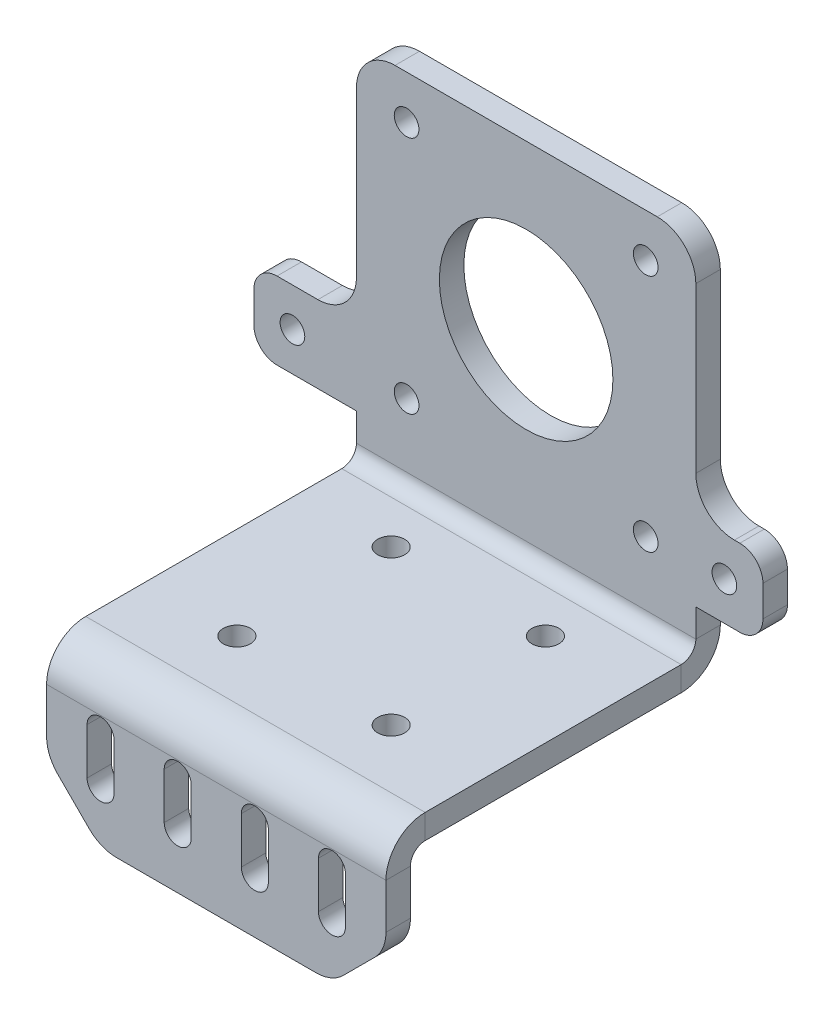
from build123d import *

# Parameters (mm, degrees)
SKETCH1_W                    = 44
SKETCH1_H                    = 37
SKETCH1_R                    = 1.75
BASE_FLANGE1_DEPTH           = 3.175
EDGE_FLANGE1_STRIP_W         = 16.51
EDGE_FLANGE1_STRIP_H         = 3.175
EDGE_FLANGE1_STRIP_CUT_DEPTH = 44
EDGE_FLANGE1_DEPTH           = 44
EDGE_FLANGE2_STRIP_W         = 16.51
EDGE_FLANGE2_STRIP_H         = 3.175
EDGE_FLANGE2_STRIP_CUT_DEPTH = 44
EDGE_FLANGE2_DEPTH           = 44
CUT_EXTRUDE1_REACH           = 69.497
SKETCH12_R                   = 11.25
SKETCH12_R_2                 = 1.6
CUT_EXTRUDE2_REACH           = 69.497
CHAMFER1_SIZE                = 7
FILLET1_R                    = 5
SKETCH14_W                   = 8.7
SKETCH14_H                   = 10
SKETCH14_R                   = 1.6
SKETCH14_W_2                 = 13.3
BOSS_EXTRUDE1_DEPTH          = 3.175
FILLET2_R                    = 5
FILLET3_R                    = 3


# Sheet-metal steps are written as plain solids
with BuildPart() as part:
    # Sketch1 → Base-Flange1 (new body)
    with BuildSketch(Plane(origin=(0, 0, 0), x_dir=(1, 0, 0), z_dir=(0, 1, 0))):
        Rectangle(SKETCH1_W, SKETCH1_H)
        with Locations(Location((-10, 11, 0), (0, 0, 270))):
            Circle(SKETCH1_R, mode=Mode.SUBTRACT)
        with Locations(Location((10, 11, 0), (0, 0, 270))):
            Circle(SKETCH1_R, mode=Mode.SUBTRACT)
        with Locations(Location((10, -9, 0), (0, 0, 270))):
            Circle(SKETCH1_R, mode=Mode.SUBTRACT)
        with Locations(Location((-10, -9, 0), (0, 0, 270))):
            Circle(SKETCH1_R, mode=Mode.SUBTRACT)
    extrude(amount=-BASE_FLANGE1_DEPTH)

    # Edge-Flange1 strip (across the edge) → Edge-Flange1 strip cut (cut)
    with BuildSketch(Plane(origin=(22, 0, -18.5), x_dir=(0, 0, 1), z_dir=(-1, 0, 0))):
        with Locations((-6.35, -1.5875)):
            Rectangle(EDGE_FLANGE1_STRIP_W, EDGE_FLANGE1_STRIP_H)
    extrude(amount=EDGE_FLANGE1_STRIP_CUT_DEPTH, mode=Mode.SUBTRACT)

    # Edge-Flange1 section (across the edge) → Edge-Flange1 (add)
    with BuildSketch(Plane(origin=(22, 0, -18.5), x_dir=(0, 0, 1), z_dir=(-1, 0, 0))):
        with BuildLine():
            Line((-3.175, 1.905), (-3.175, 46.825))
            Line((-3.175, 46.825), (0, 46.825))
            Line((0, 46.825), (0, 1.905))
            ThreePointArc((0, 1.905), (0.557961582, 0.557961582), (1.905, 0))
            Line((1.905, 0), (1.905, -3.175))
            ThreePointArc((1.905, -3.175), (-1.687102448, -1.687102448), (-3.175, 1.905))
        make_face()
    extrude(amount=EDGE_FLANGE1_DEPTH)

    # Edge-Flange2 strip (across the edge) → Edge-Flange2 strip cut (cut)
    with BuildSketch(Plane(origin=(22, -3.175, 18.5), x_dir=(0, 0, -1), z_dir=(-1, 0, 0))):
        with Locations((-6.35, -1.5875)):
            Rectangle(EDGE_FLANGE2_STRIP_W, EDGE_FLANGE2_STRIP_H)
    extrude(amount=EDGE_FLANGE2_STRIP_CUT_DEPTH, mode=Mode.SUBTRACT)

    # Edge-Flange2 section (across the edge) → Edge-Flange2 (add)
    with BuildSketch(Plane(origin=(22, -3.175, 18.5), x_dir=(0, 0, -1), z_dir=(-1, 0, 0))):
        with BuildLine():
            Line((-3.175, 1.905), (-3.175, 16.825))
            Line((-3.175, 16.825), (0, 16.825))
            Line((0, 16.825), (0, 1.905))
            ThreePointArc((0, 1.905), (0.557961582, 0.557961582), (1.905, 0))
            Line((1.905, 0), (1.905, -3.175))
            ThreePointArc((1.905, -3.175), (-1.687102448, -1.687102448), (-3.175, 1.905))
        make_face()
    extrude(amount=EDGE_FLANGE2_DEPTH)

    # Sketch12 → Cut-Extrude1 (cut, up to next)
    with BuildSketch(Plane(origin=(0, 0, -21.675), x_dir=(-1, 0, 0), z_dir=(0, 0, -1)), mode=Mode.PRIVATE) as cut_extrude1_sk1:
        with Locations(Location((0, 25.675, 0), (0, 0, 90))):
            Circle(SKETCH12_R)
    cut_extrude1_tool1 = extrude(cut_extrude1_sk1.sketch, amount=-CUT_EXTRUDE1_REACH, mode=Mode.PRIVATE) & part.part
    # Sketch12 → Cut-Extrude1 (cut, up to next)
    with BuildSketch(Plane(origin=(0, 0, -21.675), x_dir=(-1, 0, 0), z_dir=(0, 0, -1)), mode=Mode.PRIVATE) as cut_extrude1_sk2:
        with Locations(Location((15.5, 41.175, 0), (0, 0, 90))):
            Circle(SKETCH12_R_2)
    cut_extrude1_tool2 = extrude(cut_extrude1_sk2.sketch, amount=-CUT_EXTRUDE1_REACH, mode=Mode.PRIVATE) & part.part
    # Sketch12 → Cut-Extrude1 (cut, up to next)
    with BuildSketch(Plane(origin=(0, 0, -21.675), x_dir=(-1, 0, 0), z_dir=(0, 0, -1)), mode=Mode.PRIVATE) as cut_extrude1_sk3:
        with Locations(Location((15.5, 10.175, 0), (0, 0, 90))):
            Circle(SKETCH12_R_2)
    cut_extrude1_tool3 = extrude(cut_extrude1_sk3.sketch, amount=-CUT_EXTRUDE1_REACH, mode=Mode.PRIVATE) & part.part
    # Sketch12 → Cut-Extrude1 (cut, up to next)
    with BuildSketch(Plane(origin=(0, 0, -21.675), x_dir=(-1, 0, 0), z_dir=(0, 0, -1)), mode=Mode.PRIVATE) as cut_extrude1_sk4:
        with Locations(Location((-15.5, 10.175, 0), (0, 0, 90))):
            Circle(SKETCH12_R_2)
    cut_extrude1_tool4 = extrude(cut_extrude1_sk4.sketch, amount=-CUT_EXTRUDE1_REACH, mode=Mode.PRIVATE) & part.part
    # Sketch12 → Cut-Extrude1 (cut, up to next)
    with BuildSketch(Plane(origin=(0, 0, -21.675), x_dir=(-1, 0, 0), z_dir=(0, 0, -1)), mode=Mode.PRIVATE) as cut_extrude1_sk5:
        with Locations(Location((-15.5, 41.175, 0), (0, 0, 90))):
            Circle(SKETCH12_R_2)
    cut_extrude1_tool5 = extrude(cut_extrude1_sk5.sketch, amount=-CUT_EXTRUDE1_REACH, mode=Mode.PRIVATE) & part.part
    add(cut_extrude1_tool1.solids().sort_by_distance((0, 25.675, -21.675))[0], mode=Mode.SUBTRACT)
    add(cut_extrude1_tool2.solids().sort_by_distance((-15.5, 41.175, -21.675))[0], mode=Mode.SUBTRACT)
    add(cut_extrude1_tool3.solids().sort_by_distance((-15.5, 10.175, -21.675))[0], mode=Mode.SUBTRACT)
    add(cut_extrude1_tool4.solids().sort_by_distance((15.5, 10.175, -21.675))[0], mode=Mode.SUBTRACT)
    add(cut_extrude1_tool5.solids().sort_by_distance((15.5, 41.175, -21.675))[0], mode=Mode.SUBTRACT)

    # Sketch13 → Cut-Extrude2 (cut, up to next)
    with BuildSketch(Plane.XY.offset(21.675), mode=Mode.PRIVATE) as cut_extrude2_sk1:
        with BuildLine():
            Line((-6.75, -12.975), (-6.75, -6.975))
            ThreePointArc((-6.75, -6.975), (-5, -5.225), (-3.25, -6.975))
            Line((-3.25, -6.975), (-3.25, -12.975))
            ThreePointArc((-3.25, -12.975), (-5, -14.725), (-6.75, -12.975))
        make_face()
    cut_extrude2_tool1 = extrude(cut_extrude2_sk1.sketch, amount=-CUT_EXTRUDE2_REACH, mode=Mode.PRIVATE) & part.part
    # Sketch13 → Cut-Extrude2 (cut, up to next)
    with BuildSketch(Plane.XY.offset(21.675), mode=Mode.PRIVATE) as cut_extrude2_sk2:
        with BuildLine():
            Line((-16.75, -12.975), (-16.75, -6.975))
            ThreePointArc((-16.75, -6.975), (-15, -5.225), (-13.25, -6.975))
            Line((-13.25, -6.975), (-13.25, -12.975))
            ThreePointArc((-13.25, -12.975), (-15, -14.725), (-16.75, -12.975))
        make_face()
    cut_extrude2_tool2 = extrude(cut_extrude2_sk2.sketch, amount=-CUT_EXTRUDE2_REACH, mode=Mode.PRIVATE) & part.part
    # Sketch13 → Cut-Extrude2 (cut, up to next)
    with BuildSketch(Plane.XY.offset(21.675), mode=Mode.PRIVATE) as cut_extrude2_sk3:
        with BuildLine():
            Line((16.75, -12.975), (16.75, -6.975))
            ThreePointArc((16.75, -6.975), (15, -5.225), (13.25, -6.975))
            Line((13.25, -6.975), (13.25, -12.975))
            ThreePointArc((13.25, -12.975), (15, -14.725), (16.75, -12.975))
        make_face()
    cut_extrude2_tool3 = extrude(cut_extrude2_sk3.sketch, amount=-CUT_EXTRUDE2_REACH, mode=Mode.PRIVATE) & part.part
    # Sketch13 → Cut-Extrude2 (cut, up to next)
    with BuildSketch(Plane.XY.offset(21.675), mode=Mode.PRIVATE) as cut_extrude2_sk4:
        with BuildLine():
            Line((6.75, -12.975), (6.75, -6.975))
            ThreePointArc((6.75, -6.975), (5, -5.225), (3.25, -6.975))
            Line((3.25, -6.975), (3.25, -12.975))
            ThreePointArc((3.25, -12.975), (5, -14.725), (6.75, -12.975))
        make_face()
    cut_extrude2_tool4 = extrude(cut_extrude2_sk4.sketch, amount=-CUT_EXTRUDE2_REACH, mode=Mode.PRIVATE) & part.part
    add(cut_extrude2_tool1.solids().sort_by_distance((-5, -9.975, 21.675))[0], mode=Mode.SUBTRACT)
    add(cut_extrude2_tool2.solids().sort_by_distance((-15, -9.975, 21.675))[0], mode=Mode.SUBTRACT)
    add(cut_extrude2_tool3.solids().sort_by_distance((15, -9.975, 21.675))[0], mode=Mode.SUBTRACT)
    add(cut_extrude2_tool4.solids().sort_by_distance((5, -9.975, 21.675))[0], mode=Mode.SUBTRACT)

    # Chamfer1
    chamfer1_edges = [part.edges().sort_by_distance(p)[0] for p in [
        (22, -20, 20.0875),
        (-22, -20, 20.0875),
    ]]
    chamfer(chamfer1_edges, length=CHAMFER1_SIZE)

    # Fillet1
    fillet1_edges = [part.edges().sort_by_distance(p)[0] for p in [
        (15, -20, 20.0875),
        (-15, -20, 20.0875),
        (-22, -13, 20.0875),
        (22, -13, 20.0875),
        (22, 46.825, -20.0875),
        (-22, 46.825, -20.0875),
    ]]
    fillet(fillet1_edges, radius=FILLET1_R)

    # Sketch14 → Boss-Extrude1 (add)
    # profile 1 of 2: a face of its own
    with BuildSketch(Plane(origin=(0, 0, -21.675), x_dir=(-1, 0, 0), z_dir=(0, 0, -1))):
        with Locations((-26.35, 10.525)):
            Rectangle(SKETCH14_W, SKETCH14_H)
        with Locations(Location((-25.7, 10.525, 0), (0, 0, 90))):
            Circle(SKETCH14_R, mode=Mode.SUBTRACT)
    # profile 2 of 2: a face of its own
    with BuildSketch(Plane(origin=(0, 0, -21.675), x_dir=(-1, 0, 0), z_dir=(0, 0, -1))):
        with Locations((28.65, 10.525)):
            Rectangle(SKETCH14_W_2, SKETCH14_H)
        with Locations(Location((30.3, 10.525, 0), (0, 0, 90))):
            Circle(SKETCH14_R, mode=Mode.SUBTRACT)
    extrude(amount=-BOSS_EXTRUDE1_DEPTH)

    # Fillet2
    fillet2_edges = [part.edges().sort_by_distance(p)[0] for p in [
        (-22, 15.525, -20.0875),
        (22, 15.525, -20.0875),
    ]]
    fillet(fillet2_edges, radius=FILLET2_R)

    # Fillet3
    fillet3_edges = [part.edges().sort_by_distance(p)[0] for p in [
        (-35.3, 15.525, -20.0875),
        (-35.3, 5.525, -20.0875),
        (30.7, 5.525, -20.0875),
        (30.7, 15.525, -20.0875),
    ]]
    fillet(fillet3_edges, radius=FILLET3_R)


solid = part.part
